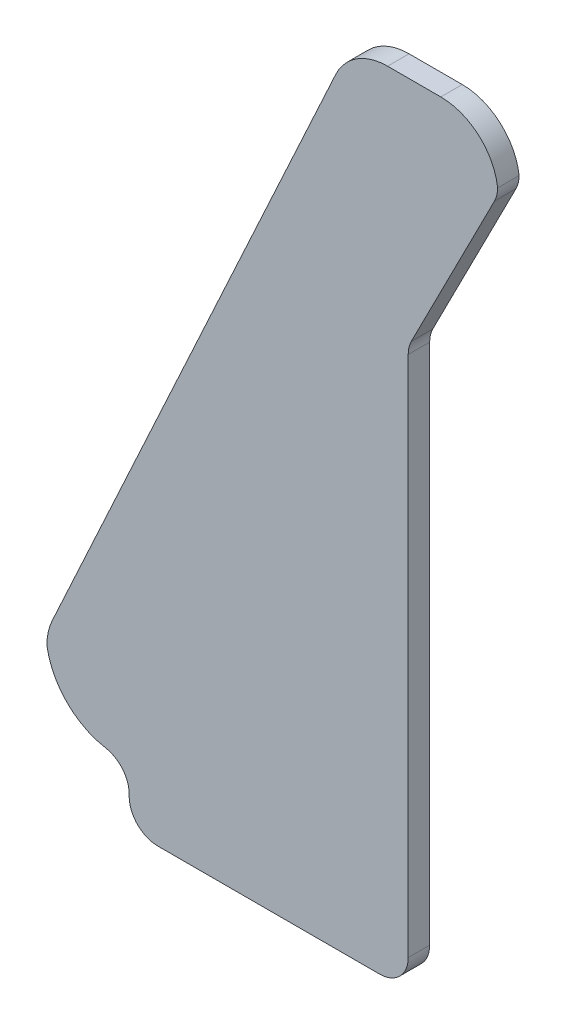
from build123d import *

# Parameters (mm, degrees)
BOSS_EXTRUDE1_DEPTH = 3
FILLET1_START       = -1
FILLET1_DEPTH       = 5
FILLET3_R           = 8


with BuildPart() as part:
    # Sketch1 → Boss-Extrude1 (new body)
    with BuildSketch(Plane.XY):
        with BuildLine():
            Line((43.039391211, 13.180231598), (31.413296253, -9.606914519))
            ThreePointArc((31.413296253, -9.606914519), (31.087115665, -10.489967002), (30.976343732, -11.424795886))
            Line((30.976343732, -11.424795886), (30.976343732, -84.424795886))
            ThreePointArc((30.976343732, -84.424795886), (29.804770857, -87.253223011), (26.976343732, -88.424795886))
            Line((26.976343732, -88.424795886), (-4.023656268, -88.424795886))
            ThreePointArc((-4.023656268, -88.424795886), (-6.852083393, -87.253223011), (-8.023656268, -84.424795886))
            Line((-8.023656268, -84.424795886), (-8.023656268, -84.124795886))
            ThreePointArc((-8.023656268, -84.124795886), (-9.195229143, -81.296368761), (-12.023656268, -80.124795886))
            Line((-12.023656268, -80.124795886), (-19.523656268, -80.124795886))
            Line((-19.523656268, -80.124795886), (-19.523656268, -71.88053816))
            ThreePointArc((-19.523656268, -71.88053816), (-19.337683681, -70.165610877), (-18.788412372, -68.530415961))
            Line((-18.788412372, -68.530415961), (20.832065435, 17.386780739))
            ThreePointArc((20.832065435, 17.386780739), (23.784106477, 20.774647022), (28.096821539, 22.036658539))
            Line((28.096821539, 22.036658539), (43.476343732, 22.036658539))
            Line((43.476343732, 22.036658539), (43.476343732, 14.998112965))
            ThreePointArc((43.476343732, 14.998112965), (43.365571799, 14.063284081), (43.039391211, 13.180231598))
        make_face()
    extrude(amount=BOSS_EXTRUDE1_DEPTH)

    # Fillet1: read off the stored shape, not the designer's step
    # Fillet1 outline → Fillet1 (cut)
    with BuildSketch(Plane.XY.offset(FILLET1_START)):
        with BuildLine():
            ThreePointArc((-12.023656268, -80.124795886), (-11.682584861, -80.139363626), (-11.343997774, -80.182960738))
            ThreePointArc((-11.343997774, -80.182960738), (-16.768389445, -77.346578315), (-19.523656268, -71.88053816))
            Line((-19.523656268, -71.88053816), (-19.523656268, -80.124795886))
            Line((-19.523656268, -80.124795886), (-12.023656268, -80.124795886))
        make_face()
    extrude(amount=FILLET1_DEPTH, mode=Mode.SUBTRACT)

    # Fillet3
    # the kernel refuses this fillet: 8 mm, written as the material it takes off along each edge
    with BuildSketch(Plane(origin=(43.476343732, 22.036658539, -19.855037992), x_dir=(-1, 0, 0), z_dir=(0, 0, 1))) as fillet3_piece_1:
        with BuildLine():
            CenterArc((7.942015197, 8), FILLET3_R, 186.902595068, 83.097404932)
            Line((0, 7.038545575), (0, 0))
            Line((0, 0), (7.942015197, 0))
        make_face()
    extrude(amount=42.710075985, mode=Mode.SUBTRACT)


solid = part.part
